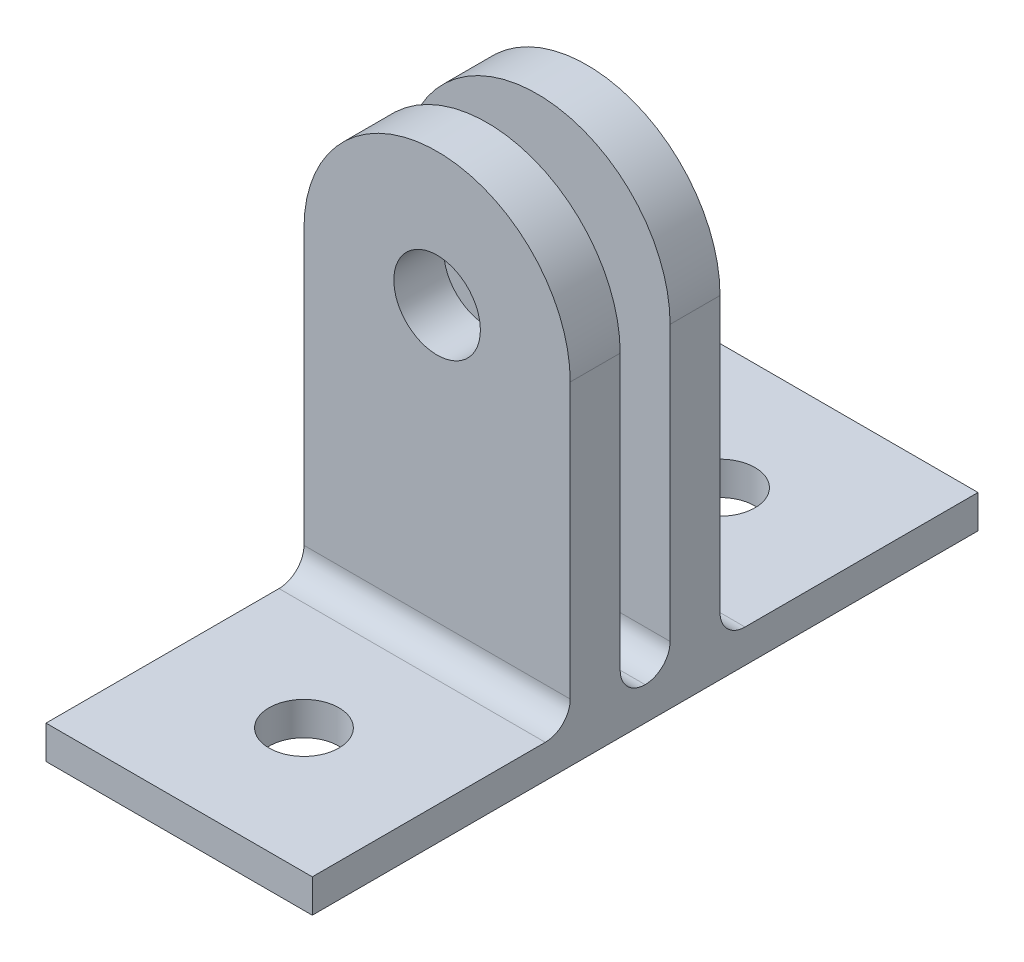
from build123d import *

# Parameters (mm, degrees)
SKETCH_2_W          = 16
SKETCH_2_H          = 40
EXTRUDE_1_DEPTH     = 2
EXTRUDE_START       = 1.5
SKETCH_4_R          = 2.6
EXTRUDE_2_DEPTH     = 3
FILLET_2_R          = 1.5
SKETCH_5_R          = 2.1
CUT_EXTRUDE_1_DEPTH = 34.763886032


with BuildPart() as part:
    # 草圖2 → 填料-伸長1 (new body)
    with BuildSketch(Plane(origin=(0, 0, 0), x_dir=(1, 0, 0), z_dir=(0, 1, 0))):
        Rectangle(SKETCH_2_W, SKETCH_2_H)
    extrude(amount=EXTRUDE_1_DEPTH)

    # 草圖4 → 填料-伸長2 (add)
    with BuildSketch(Plane.XY.offset(EXTRUDE_START)):
        with BuildLine():
            Line((8, 20), (8, 2))
            Line((8, 2), (-8, 2))
            Line((-8, 2), (-8, 20))
            ThreePointArc((-8, 20), (0, 28), (8, 20))
        make_face()
        with Locations((0, 20)):
            Circle(SKETCH_4_R, mode=Mode.SUBTRACT)
    extrude_2 = extrude(amount=EXTRUDE_2_DEPTH)

    # 鏡射1: 填料-伸長2 across plane
    add(extrude_2.mirror(Plane.XY))

    # 圓角2
    fillet_2_edges = [part.edges().sort_by_distance(p)[0] for p in [
        (0, 2, 4.5),
        (0, 2, 1.5),
        (0, 2, -4.5),
        (0, 2, -1.5),
    ]]
    fillet(fillet_2_edges, radius=FILLET_2_R - 0.0001)  # a hair under: the kernel refuses the full size

    # 草圖5 → 除料-伸長1 (cut, through all)
    with BuildSketch(Plane(origin=(0, 2, 0), x_dir=(1, 0, 0), z_dir=(0, 1, 0))):
        with Locations(Location((0, -12.5, 0), (0, 0, 270))):
            Circle(SKETCH_5_R)
        with Locations(Location((0, 12.5, 0), (0, 0, 90))):
            Circle(SKETCH_5_R)
    extrude(amount=-CUT_EXTRUDE_1_DEPTH, mode=Mode.SUBTRACT)


solid = part.part
